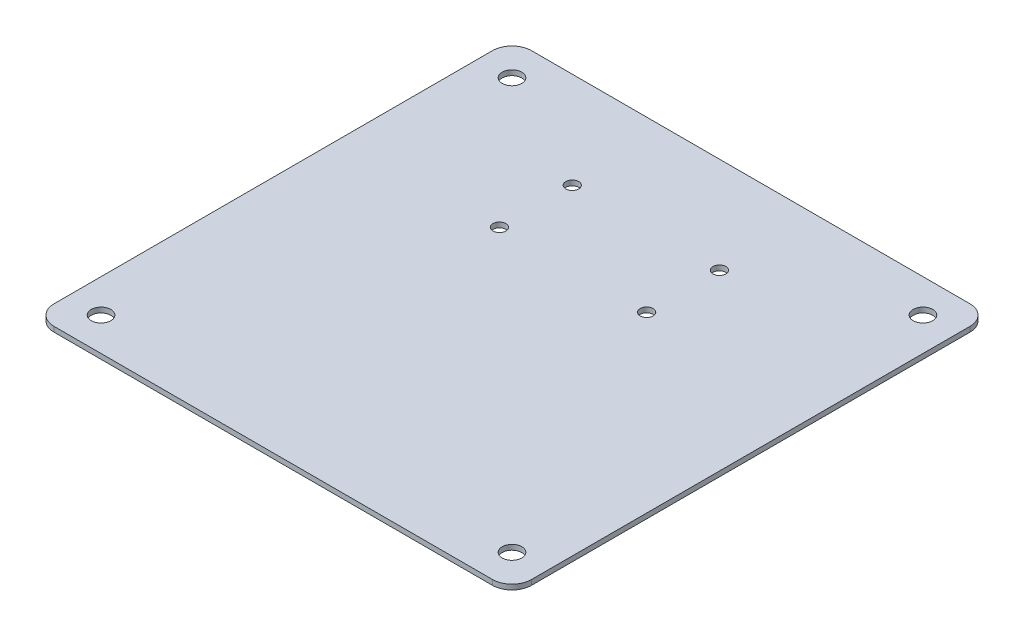
from build123d import *

# Parameters (mm, degrees)
SKETCH1_W          = 122
SKETCH1_H          = 122
BASE_FLANGE1_DEPTH = 1.3
FILLET1_R          = 5
SKETCH3_R          = 2.5
CUT_EXTRUDE1_DEPTH = 10
SKETCH4_R          = 1.649999999
CUT_EXTRUDE2_DEPTH = 10


# Sheet-metal steps are written as plain solids
with BuildPart() as part:
    # Sketch1 → Base-Flange1 (new body)
    with BuildSketch(Plane(origin=(0, 0, 0), x_dir=(1, 0, 0), z_dir=(0, 1, 0))):
        Rectangle(SKETCH1_W, SKETCH1_H)
    extrude(amount=-BASE_FLANGE1_DEPTH)

    # Fillet1
    fillet1_edges = [part.edges().sort_by_distance(p)[0] for p in [
        (61, -0.65, 61),
        (-61, -0.65, 61),
        (-61, -0.65, -61),
        (61, -0.65, -61),
    ]]
    fillet(fillet1_edges, radius=FILLET1_R)

    # Sketch3 → Cut-Extrude1 (cut)
    with BuildSketch(Plane(origin=(0, 0, 0), x_dir=(1, 0, 0), z_dir=(0, 1, 0))):
        with Locations(Location((52.5, 52.5, 0), (0, 0, 270))):
            Circle(SKETCH3_R)
        with Locations(Location((-52.5, 52.5, 0), (0, 0, 270))):
            Circle(SKETCH3_R)
        with Locations(Location((-52.5, -52.5, 0), (0, 0, 270))):
            Circle(SKETCH3_R)
        with Locations(Location((52.5, -52.5, 0), (0, 0, 270))):
            Circle(SKETCH3_R)
    extrude(amount=-CUT_EXTRUDE1_DEPTH, mode=Mode.SUBTRACT)

    # Sketch4 → Cut-Extrude2 (cut)
    with BuildSketch(Plane(origin=(0, -1.3, 0), x_dir=(-1, 0, 0), z_dir=(0, -1, 0))):
        with Locations(Location((21.023848249, 36.422526924, 0), (0, 0, 90))):
            Circle(SKETCH4_R)
        with Locations(Location((21.023848249, 17.822526924, 0), (0, 0, 90))):
            Circle(SKETCH4_R)
        with Locations(Location((-16.576151751, 17.822526924, 0), (0, 0, 90))):
            Circle(SKETCH4_R)
        with Locations(Location((-16.576151751, 36.422526924, 0), (0, 0, 90))):
            Circle(SKETCH4_R)
    extrude(amount=-CUT_EXTRUDE2_DEPTH, mode=Mode.SUBTRACT)


solid = part.part
